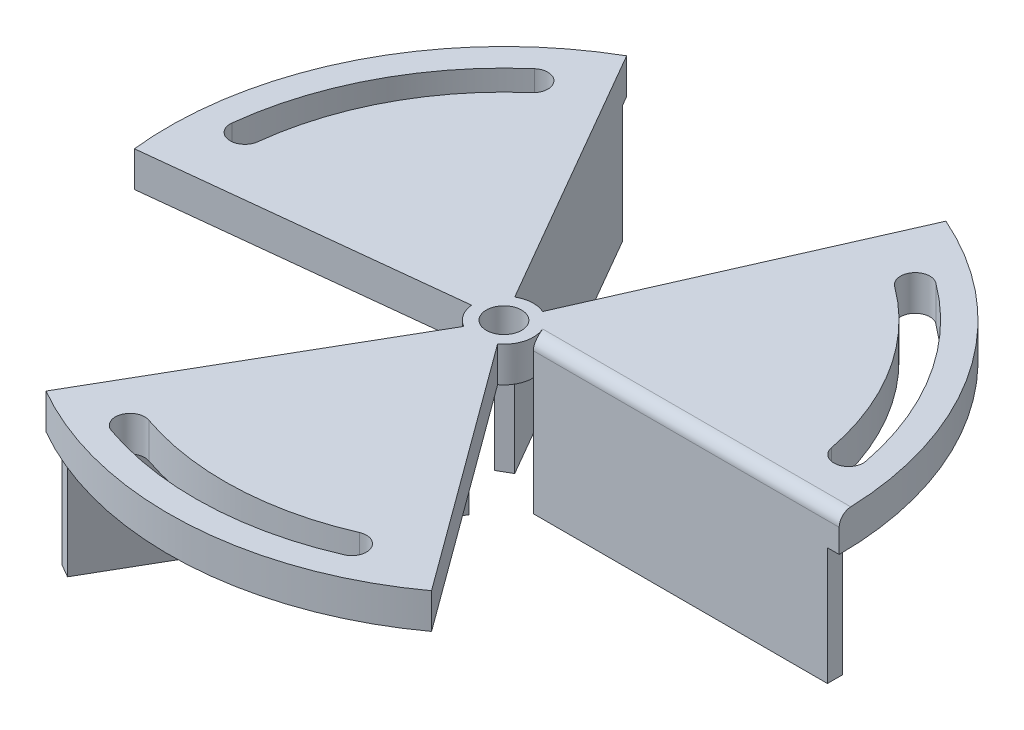
from build123d import *

# Parameters (mm, degrees)
SKETCH1_R           = 0.762
BOSS_EXTRUDE1_DEPTH = 1.524
SKETCH2_W           = 12.7
SKETCH2_H           = 0.641845345
BOSS_EXTRUDE2_DEPTH = 5.08
FILLET1_R           = 0.508
CIRPATTERN1_START   = -13.97
CIRPATTERN1_DEPTH   = 12.7
CIRPATTERN1_2_DEPTH = 12.7


# Read off the part's stored shape, not the designer's step: CirPattern1
with BuildPart() as part:
    # Sketch1 → Boss-Extrude1 (new body)
    with BuildSketch(Plane(origin=(0, 0, 0), x_dir=(1, 0, 0), z_dir=(0, 1, 0))):
        with BuildLine():
            Line((1.27, 0), (14.478, 0))
            ThreePointArc((14.478, 0), (12.127384736, 7.908161825), (5.838820078, 13.248421193))
            Line((5.838820078, 13.248421193), (0.5121772, 1.16214221))
            ThreePointArc((0.5121772, 1.16214221), (-0.068857603, 1.268131945), (-0.635, 1.099852263))
            Line((-0.635, 1.099852263), (-7.239, 12.538315796))
            ThreePointArc((-7.239, 12.538315796), (-12.912361406, 6.548542351), (-14.392879352, -1.56764408))
            Line((-14.392879352, -1.56764408), (-1.262533276, -0.137512639))
            ThreePointArc((-1.262533276, -0.137512639), (-1.063805679, -0.693698406), (-0.635, -1.099852263))
            Line((-0.635, -1.099852263), (-7.239, -12.538315796))
            ThreePointArc((-7.239, -12.538315796), (0.78497667, -14.456704176), (8.554059274, -11.680777112))
            Line((8.554059274, -11.680777112), (0.750356077, -1.024629571))
            ThreePointArc((0.750356077, -1.024629571), (1.132663281, -0.57443354), (1.27, 0))
        make_face()
        with Locations(Location((0, 0, 0), (0, 0, 90))):
            Circle(SKETCH1_R, mode=Mode.SUBTRACT)
        with BuildLine():
            ThreePointArc((13.091283697, 2.537817206), (12.588737673, 1.793574306), (11.844494773, 2.296120329))
            ThreePointArc((11.844494773, 2.296120329), (10.203630871, 6.438178474), (7.171403907, 9.702329153))
            ThreePointArc((7.171403907, 9.702329153), (7.038197315, 10.590420367), (7.926288529, 10.723626959))
            ThreePointArc((7.926288529, 10.723626959), (11.277697278, 7.115881471), (13.091283697, 2.537817206))
        make_face(mode=Mode.SUBTRACT)
        with BuildLine():
            ThreePointArc((-4.347827678, -12.606292852), (-4.741087925, -11.79895378), (-3.933748852, -11.405693533))
            ThreePointArc((-3.933748852, -11.405693533), (0.473810677, -12.055692782), (4.816761569, -11.061782541))
            ThreePointArc((4.816761569, -11.061782541), (5.652474417, -11.390467855), (5.323789103, -12.226180703))
            ThreePointArc((5.323789103, -12.226180703), (0.523685485, -13.324713074), (-4.347827678, -12.606292852))
        make_face(mode=Mode.SUBTRACT)
        with BuildLine():
            ThreePointArc((-8.743456019, 10.068475647), (-7.847649749, 10.005379474), (-7.910745922, 9.109573204))
            ThreePointArc((-7.910745922, 9.109573204), (-10.677441547, 5.617514308), (-11.988165476, 1.359453388))
            ThreePointArc((-11.988165476, 1.359453388), (-12.690671732, 0.800047488), (-13.250077632, 1.502553744))
            ThreePointArc((-13.250077632, 1.502553744), (-11.801382763, 6.208831604), (-8.743456019, 10.068475647))
        make_face(mode=Mode.SUBTRACT)
    extrude(amount=BOSS_EXTRUDE1_DEPTH)

    # Sketch2 → Boss-Extrude2 (add)
    with BuildSketch(Plane.XZ):
        with Locations((7.62, -0.320922673)):
            Rectangle(SKETCH2_W, SKETCH2_H)
    extrude(amount=BOSS_EXTRUDE2_DEPTH)

    # Fillet1
    fillet1_edges = [part.edges().sort_by_distance(p)[0] for p in [
        (7.62, 0, -0.641845345),
        (7.874, 1.524, 0),
    ]]
    fillet(fillet1_edges, radius=FILLET1_R)

    # CirPattern1 outline → CirPattern1 (add)
    with BuildSketch(Plane(origin=(0, 0, 0), x_dir=(0.8660254037844362, 0, -0.5000000000000042), z_dir=(0.5000000000000042, 0, 0.8660254037844363)).offset(CIRPATTERN1_START)):
        with BuildLine():
            Line((-0.641845345, -0.508), (-0.641845345, -5.08))
            Line((-0.641845345, -5.08), (0, -5.08))
            Line((0, -5.08), (0, 0))
            Line((0, 0), (-1.149845345, 0))
            ThreePointArc((-1.149845345, 0), (-0.7906351, -0.148789755), (-0.641845345, -0.508))
        make_face()
    extrude(amount=CIRPATTERN1_DEPTH)

    # CirPattern1 2 outline → CirPattern1 2 (add)
    with BuildSketch(Plane(origin=(0, 0, 0), x_dir=(0.8660254037844431, 0, 0.4999999999999921), z_dir=(0.4999999999999921, 0, -0.8660254037844433)).offset(CIRPATTERN1_START)):
        with BuildLine():
            Line((0.641845345, 0.508), (0.641845345, 5.08))
            Line((0.641845345, 5.08), (0, 5.08))
            Line((0, 5.08), (0, 0))
            Line((0, 0), (1.149845345, 0))
            ThreePointArc((1.149845345, 0), (0.7906351, 0.148789755), (0.641845345, 0.508))
        make_face()
    extrude(amount=CIRPATTERN1_2_DEPTH)


solid = part.part
